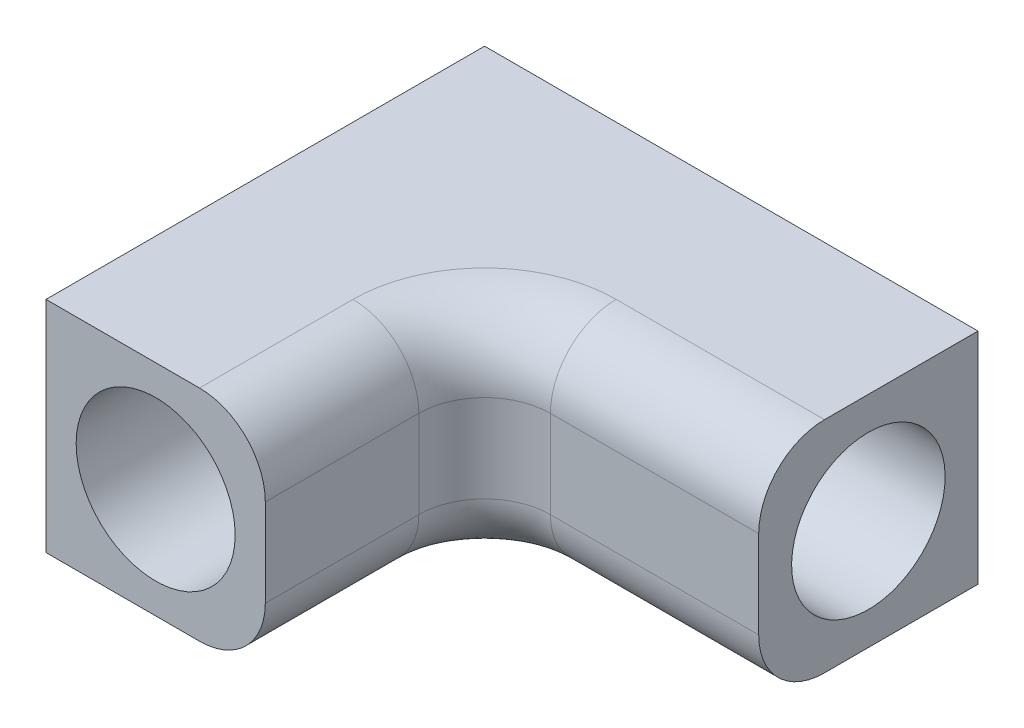
from build123d import *

# Parameters (mm, degrees)
SKETCH_2_W                 = 20
SKETCH_2_H                 = 20
EXTRUDE_482_DEPTH          = 40
SKETCH_4_W                 = 20
SKETCH_4_H                 = 20
EXTRUDE_639_DEPTH          = 25
SKETCH_7_R                 = 6
CUT_EXTRUDE_822_DEPTH      = 44
CUT_EXTRUDE_968_REACH      = 56.083
CUT_EXTRUDE_968_END_RADIUS = 6
SKETCH_8_R                 = 6
SKETCH_9_R                 = 7.25
CUT_EXTRUDE_1104_DEPTH     = 20
SKETCH_10_R                = 7
CUT_EXTRUDE_1247_DEPTH     = 20
CUT_EXTRUDE_1380_REACH     = 63.033
SKETCH_11_R                = 4
FILLET_2_R                 = 6
FILLET_5_R                 = 1


with BuildPart() as part:
    # Эскиз2 → Extrude 482 (new body)
    with BuildSketch(Plane.XY):
        Rectangle(SKETCH_2_W, SKETCH_2_H)
    extrude(amount=EXTRUDE_482_DEPTH)

    # Эскиз4 → Extrude 639 (add)
    with BuildSketch(Plane(origin=(10, 0, 0), x_dir=(0, 0, -1), z_dir=(1, 0, 0))):
        with Locations((-10, 0)):
            Rectangle(SKETCH_4_W, SKETCH_4_H)
    extrude(amount=EXTRUDE_639_DEPTH)

    # Эскиз7 → Cut-Extrude 822 (cut)
    with BuildSketch(Plane(origin=(35, 0, 0), x_dir=(0, 0, -1), z_dir=(1, 0, 0))):
        with Locations(Location((-10, 0, 0), (0, 0, 90))):
            Circle(SKETCH_7_R)
    extrude(amount=-CUT_EXTRUDE_822_DEPTH, mode=Mode.SUBTRACT)

    # Cut-Extrude 968: up to this cylinder (the profile starts outside it)
    cut_extrude_968_end = Plane(origin=(0, 0, 10), z_dir=(1, 0, 0)) * Cylinder(CUT_EXTRUDE_968_END_RADIUS, 125.166, mode=Mode.PRIVATE)
    # Эскиз8 → Cut-Extrude 968 (cut, up to the surface)
    with BuildSketch(Plane.XY.offset(40), mode=Mode.PRIVATE) as cut_extrude_968_sk1:
        Circle(SKETCH_8_R)
    cut_extrude_968_tool1 = extrude(cut_extrude_968_sk1.sketch, amount=-CUT_EXTRUDE_968_REACH, mode=Mode.PRIVATE) - cut_extrude_968_end
    add(cut_extrude_968_tool1.solids().sort_by_distance((0, 0, 40))[0], mode=Mode.SUBTRACT)

    # Эскиз9 → Cut-Extrude 1104 (cut)
    with BuildSketch(Plane.XY.offset(40)):
        Circle(SKETCH_9_R)
    extrude(amount=-CUT_EXTRUDE_1104_DEPTH, mode=Mode.SUBTRACT)

    # Эскиз10 → Cut-Extrude 1247 (cut)
    with BuildSketch(Plane(origin=(35, 0, 0), x_dir=(0, 0, -1), z_dir=(1, 0, 0))):
        with Locations(Location((-10, 0, 0), (0, 0, 90))):
            Circle(SKETCH_10_R)
    extrude(amount=-CUT_EXTRUDE_1247_DEPTH, mode=Mode.SUBTRACT)

    # Эскиз11 → Cut-Extrude 1380 (cut, up to next)
    with BuildSketch(Plane.ZY.offset(10), mode=Mode.PRIVATE) as cut_extrude_1380_sk1:
        with Locations(Location((10, 0, 0), (0, 0, 270))):
            Circle(SKETCH_11_R)
    cut_extrude_1380_tool1 = extrude(cut_extrude_1380_sk1.sketch, amount=-CUT_EXTRUDE_1380_REACH, mode=Mode.PRIVATE) & part.part
    add(cut_extrude_1380_tool1.solids().sort_by_distance((-10, 0, 10))[0], mode=Mode.SUBTRACT)

    # Скругление2
    fillet_2_edges = [part.edges().sort_by_distance(p)[0] for p in [
        (10, 0, 20),
        (22.5, 10, 20),
        (22.5, -10, 20),
        (10, -10, 30),
        (10, 10, 30),
    ]]
    fillet(fillet_2_edges, radius=FILLET_2_R)

    # Скругление5
    fillet_5_edges = [part.edges().sort_by_distance(p)[0] for p in [
        (-9, 4, 10),
    ]]
    fillet(fillet_5_edges, radius=FILLET_5_R - 0.0001)  # a hair under: the kernel refuses the full size


solid = part.part
